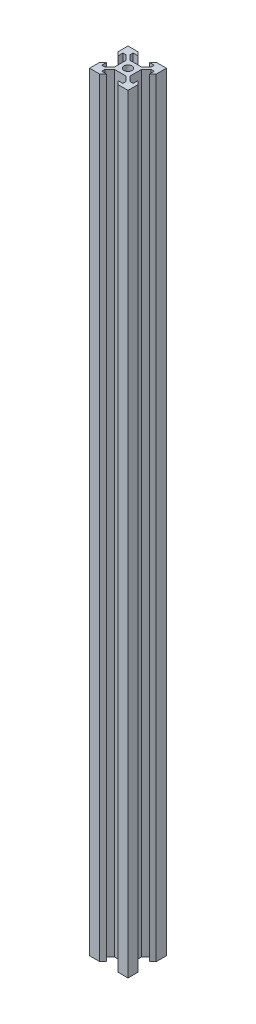
from build123d import *

# Parameters (mm, degrees)
SKETCH1_R                = 2.1
RESSALTO_EXTRUS_O1_DEPTH = 400


with BuildPart() as part:
    # Sketch1 → Ressalto-extrusão1 (new body)
    with BuildSketch(Plane(origin=(0, 0, 0), x_dir=(1, 0, 0), z_dir=(0, 1, 0))):
        Polygon((-3, 8.2), (-4.698434282, 10), (-10, 10), (-10, 4.907639309), (-8.2, 3), (-8.2, 5.499339828), (-6.56, 5.499339828), (-4.060660172, 3), (-4.060660172, -3), (-6.56, -5.499339828), (-8.2, -5.499339828), (-8.2, -3), (-10, -4.698434282), (-10, -10), (-4.907639309, -10), (-3, -8.2), (-5.499339828, -8.2), (-5.499339828, -6.56), (-3, -4.060660172), (3, -4.060660172), (5.499339828, -6.56), (5.499339828, -8.2), (3, -8.2), (4.698434282, -10), (10, -10), (10, -4.907639309), (8.2, -3), (8.2, -5.499339828), (6.56, -5.499339828), (4.060660172, -3), (4.060660172, 3), (6.56, 5.499339828), (8.2, 5.499339828), (8.2, 3), (10, 4.698434282), (10, 10), (4.907639309, 10), (3, 8.2), (5.499339828, 8.2), (5.499339828, 6.56), (3, 4.060660172), (-3, 4.060660172), (-5.499339828, 6.56), (-5.499339828, 8.2), align=None)
        Circle(SKETCH1_R, mode=Mode.SUBTRACT)
    extrude(amount=RESSALTO_EXTRUS_O1_DEPTH)


solid = part.part
